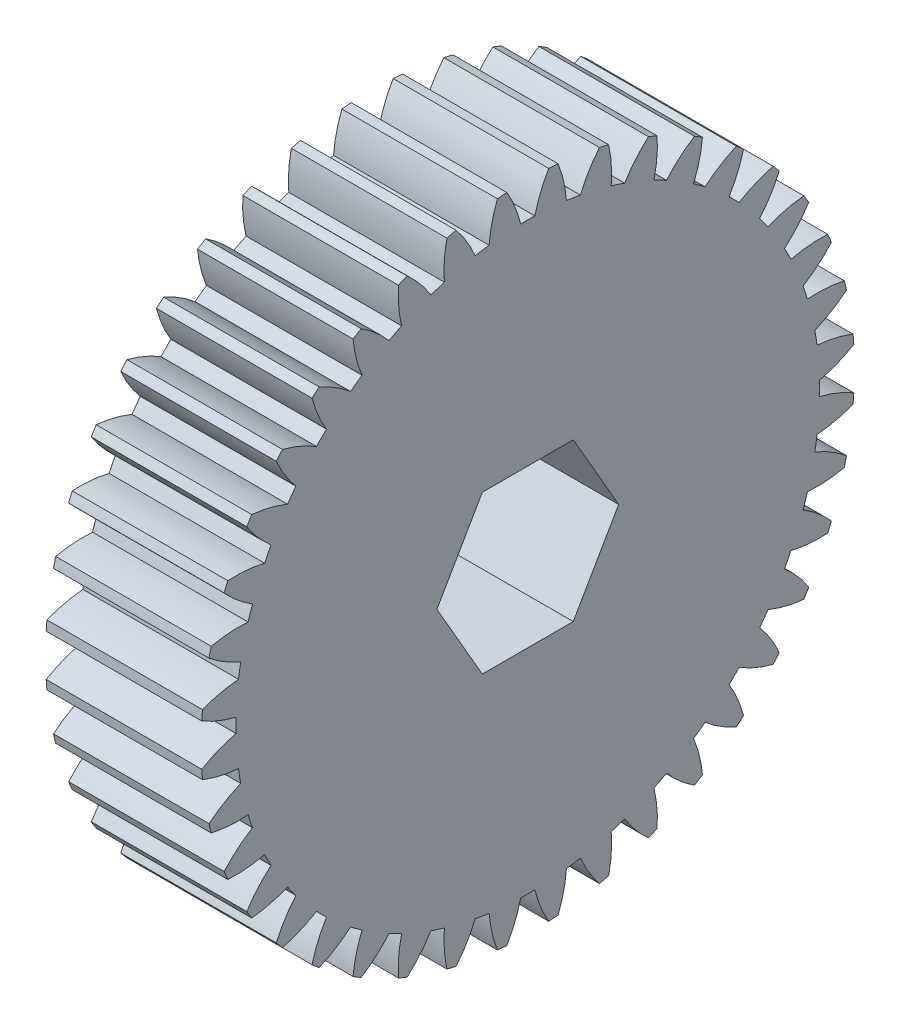
from build123d import *

# Parameters (mm, degrees)
BASPROSKE_W     = 12.7
BASPROSKE_H     = 26.67
TOOTHCUT_DEPTH  = 40.797836625
TEETHCUTS_DEPTH = 12.7
BORSKE_R        = 0.396875
BORE_DEPTH      = 50.8029464
HEX_HOLE_DEPTH  = 40.724573716


# Read off the part's stored shape, not the designer's step: TeethCuts
with BuildPart() as part:
    # BasProSke → Base-Revolve (revolve)
    with BuildSketch(Plane(origin=(0, 0, 0), x_dir=(1, 0, 0), z_dir=(0, 1, 0)), mode=Mode.PRIVATE) as base_revolve_sk:
        with Locations((6.35, 13.335)):
            Rectangle(BASPROSKE_W, BASPROSKE_H)
    revolve(base_revolve_sk.sketch.rotate(Axis((-10, 0, 0), (1, 0, 0)), 180), axis=Axis((-10, 0, 0), (1, 0, 0)))

    # TooCutSke → ToothCut (cut, through all)
    with BuildSketch(Plane(origin=(0, 0, 0), x_dir=(0, 0, -1), z_dir=(1, 0, 0))):
        with BuildLine():
            ThreePointArc((0.577296327, 23.818204886), (0, 23.8252), (-0.577296327, 23.818204886))
            ThreePointArc((-0.577296327, 23.818204886), (-1.042980967, 25.272123589), (-1.721261603, 26.639850594))
            ThreePointArc((-1.721261603, 26.639850594), (0, 26.6954), (1.721261603, 26.639850594))
            ThreePointArc((1.721261603, 26.639850594), (1.042980967, 25.272123589), (0.577296327, 23.818204886))
        make_face()
    extrude(amount=TOOTHCUT_DEPTH, mode=Mode.SUBTRACT)

    # TeethCuts outline → TeethCuts (cut)
    with BuildSketch(Plane.YZ):
        with BuildLine():
            ThreePointArc((26.020657032, 5.849299754), (24.785617983, 4.976229054), (23.434654218, 4.296176991))
            ThreePointArc((23.434654218, 4.296176991), (23.531872252, 3.727082416), (23.615272302, 3.155799288))
            ThreePointArc((23.615272302, 3.155799288), (25.110262838, 2.926502105), (26.554648458, 2.477810581))
            ThreePointArc((26.554648458, 2.477810581), (26.341648043, 4.172107183), (26.020657032, 5.849299754))
        make_face()
        with BuildLine():
            ThreePointArc((23.434654218, -4.296176991), (24.785617983, -4.976229054), (26.020657032, -5.849299754))
            ThreePointArc((26.020657032, -5.849299754), (26.341648043, -4.172107183), (26.554648458, -2.477810581))
            ThreePointArc((26.554648458, -2.477810581), (25.110262838, -2.926502105), (23.615272302, -3.155799288))
            ThreePointArc((23.615272302, -3.155799288), (23.531872252, -3.727082416), (23.434654218, -4.296176991))
        make_face()
        with BuildLine():
            ThreePointArc((22.474064587, -7.909271519), (23.702012166, -8.792288306), (24.785267487, -9.847812731))
            ThreePointArc((24.785267487, -9.847812731), (25.364677289, -8.24148324), (25.840101698, -6.601366847))
            ThreePointArc((25.840101698, -6.601366847), (24.343308043, -6.818582542), (22.830853339, -6.811188651))
            ThreePointArc((22.830853339, -6.811188651), (22.659111712, -7.362391694), (22.474064587, -7.909271519))
        make_face()
        with BuildLine():
            ThreePointArc((20.9600889, -11.327613533), (22.034784147, -12.391852241), (22.9395824, -13.603839875))
            ThreePointArc((22.9395824, -13.603839875), (23.763144, -12.107926628), (24.489285876, -10.562375552))
            ThreePointArc((24.489285876, -10.562375552), (22.976940214, -10.542766847), (21.484262996, -10.298863945))
            ThreePointArc((21.484262996, -10.298863945), (21.22840864, -10.816414454), (20.9600889, -11.327613533))
        make_face()
        with BuildLine():
            ThreePointArc((18.930006261, -14.467032108), (19.824986614, -15.686287647), (20.529048661, -17.024895332))
            ThreePointArc((20.529048661, -17.024895332), (21.57648324, -15.676232678), (22.53546256, -14.263303517))
            ThreePointArc((22.53546256, -14.263303517), (21.04480386, -14.007353243), (19.608658796, -13.532947028))
            ThreePointArc((19.608658796, -13.532947028), (19.274991694, -14.004101193), (18.930006261, -14.467032108))
        make_face()
        with BuildLine():
            ThreePointArc((16.433804043, -17.250224338), (17.127032114, -18.594474591), (17.613021612, -20.026741365))
            ThreePointArc((17.613021612, -20.026741365), (18.858537854, -18.858537854), (20.026741365, -17.613021612))
            ThreePointArc((20.026741365, -17.613021612), (18.594474591, -17.127032114), (17.250224338, -16.433804043))
            ThreePointArc((17.250224338, -16.433804043), (16.846960483, -16.846960483), (16.433804043, -17.250224338))
        make_face()
        with BuildLine():
            ThreePointArc((13.532947028, -19.608658796), (14.007353243, -21.04480386), (14.263303517, -22.53546256))
            ThreePointArc((14.263303517, -22.53546256), (15.676232678, -21.57648324), (17.024895332, -20.529048661))
            ThreePointArc((17.024895332, -20.529048661), (15.686287647, -19.824986614), (14.467032108, -18.930006261))
            ThreePointArc((14.467032108, -18.930006261), (14.004101193, -19.274991694), (13.532947028, -19.608658796))
        make_face()
        with BuildLine():
            ThreePointArc((10.298863945, -21.484262996), (10.542766847, -22.976940214), (10.562375552, -24.489285876))
            ThreePointArc((10.562375552, -24.489285876), (12.107926628, -23.763144), (13.603839875, -22.939582399))
            ThreePointArc((13.603839875, -22.939582399), (12.391852241, -22.034784147), (11.327613533, -20.9600889))
            ThreePointArc((11.327613533, -20.9600889), (10.816414454, -21.22840864), (10.298863945, -21.484262996))
        make_face()
        with BuildLine():
            ThreePointArc((6.811188651, -22.830853339), (6.818582542, -24.343308043), (6.601366847, -25.840101698))
            ThreePointArc((6.601366847, -25.840101698), (8.24148324, -25.364677289), (9.847812731, -24.785267487))
            ThreePointArc((9.847812731, -24.785267487), (8.792288306, -23.702012166), (7.909271519, -22.474064587))
            ThreePointArc((7.909271519, -22.474064587), (7.362391694, -22.659111712), (6.811188651, -22.830853339))
        make_face()
        with BuildLine():
            ThreePointArc((3.155799288, -23.615272302), (2.926502105, -25.110262838), (2.477810581, -26.554648458))
            ThreePointArc((2.477810581, -26.554648458), (4.172107183, -26.341648044), (5.849299754, -26.020657032))
            ThreePointArc((5.849299754, -26.020657032), (4.976229054, -24.785617983), (4.296176991, -23.434654218))
            ThreePointArc((4.296176991, -23.434654218), (3.727082416, -23.531872252), (3.155799288, -23.615272302))
        make_face()
        with BuildLine():
            ThreePointArc((-0.577296327, -23.818204886), (-1.037638527, -25.258919626), (-1.706757605, -26.615331643))
            ThreePointArc((-1.706757605, -26.615331643), (0, -26.67), (1.706757605, -26.615331643))
            ThreePointArc((1.706757605, -26.615331643), (1.037638527, -25.258919626), (0.577296327, -23.818204886))
            ThreePointArc((0.577296327, -23.818204886), (0, -23.8252), (-0.577296327, -23.818204886))
        make_face()
        with BuildLine():
            ThreePointArc((-4.296176991, -23.434654218), (-4.976229054, -24.785617983), (-5.849299754, -26.020657032))
            ThreePointArc((-5.849299754, -26.020657032), (-4.172107183, -26.341648044), (-2.477810581, -26.554648458))
            ThreePointArc((-2.477810581, -26.554648458), (-2.926502105, -25.110262838), (-3.155799288, -23.615272302))
            ThreePointArc((-3.155799288, -23.615272302), (-3.727082416, -23.531872252), (-4.296176991, -23.434654218))
        make_face()
        with BuildLine():
            ThreePointArc((-7.909271519, -22.474064587), (-8.792288306, -23.702012166), (-9.847812731, -24.785267487))
            ThreePointArc((-9.847812731, -24.785267487), (-8.24148324, -25.364677289), (-6.601366847, -25.840101698))
            ThreePointArc((-6.601366847, -25.840101698), (-6.818582542, -24.343308043), (-6.811188651, -22.830853339))
            ThreePointArc((-6.811188651, -22.830853339), (-7.362391694, -22.659111712), (-7.909271519, -22.474064587))
        make_face()
        with BuildLine():
            ThreePointArc((-11.327613533, -20.9600889), (-12.391852241, -22.034784147), (-13.603839875, -22.9395824))
            ThreePointArc((-13.603839875, -22.9395824), (-12.107926628, -23.763144), (-10.562375552, -24.489285876))
            ThreePointArc((-10.562375552, -24.489285876), (-10.542766847, -22.976940214), (-10.298863945, -21.484262996))
            ThreePointArc((-10.298863945, -21.484262996), (-10.816414454, -21.22840864), (-11.327613533, -20.9600889))
        make_face()
        with BuildLine():
            ThreePointArc((-14.467032108, -18.930006261), (-15.686287647, -19.824986614), (-17.024895332, -20.529048661))
            ThreePointArc((-17.024895332, -20.529048661), (-15.676232678, -21.57648324), (-14.263303517, -22.53546256))
            ThreePointArc((-14.263303517, -22.53546256), (-14.007353243, -21.04480386), (-13.532947028, -19.608658796))
            ThreePointArc((-13.532947028, -19.608658796), (-14.004101193, -19.274991694), (-14.467032108, -18.930006261))
        make_face()
        with BuildLine():
            ThreePointArc((-17.250224338, -16.433804043), (-18.594474591, -17.127032114), (-20.026741365, -17.613021612))
            ThreePointArc((-20.026741365, -17.613021612), (-18.858537854, -18.858537854), (-17.613021612, -20.026741365))
            ThreePointArc((-17.613021612, -20.026741365), (-17.127032114, -18.594474591), (-16.433804043, -17.250224338))
            ThreePointArc((-16.433804043, -17.250224338), (-16.846960483, -16.846960483), (-17.250224338, -16.433804043))
        make_face()
        with BuildLine():
            ThreePointArc((-19.608658796, -13.532947028), (-21.04480386, -14.007353243), (-22.53546256, -14.263303517))
            ThreePointArc((-22.53546256, -14.263303517), (-21.57648324, -15.676232678), (-20.529048661, -17.024895332))
            ThreePointArc((-20.529048661, -17.024895332), (-19.824986614, -15.686287647), (-18.930006261, -14.467032108))
            ThreePointArc((-18.930006261, -14.467032108), (-19.274991694, -14.004101193), (-19.608658796, -13.532947028))
        make_face()
        with BuildLine():
            ThreePointArc((-21.484262996, -10.298863945), (-22.976940214, -10.542766847), (-24.489285876, -10.562375552))
            ThreePointArc((-24.489285876, -10.562375552), (-23.763144, -12.107926628), (-22.939582399, -13.603839875))
            ThreePointArc((-22.939582399, -13.603839875), (-22.034784147, -12.391852241), (-20.9600889, -11.327613533))
            ThreePointArc((-20.9600889, -11.327613533), (-21.22840864, -10.816414454), (-21.484262996, -10.298863945))
        make_face()
        with BuildLine():
            ThreePointArc((-22.830853339, -6.811188651), (-24.343308043, -6.818582542), (-25.840101698, -6.601366847))
            ThreePointArc((-25.840101698, -6.601366847), (-25.364677289, -8.24148324), (-24.785267487, -9.847812731))
            ThreePointArc((-24.785267487, -9.847812731), (-23.702012166, -8.792288306), (-22.474064587, -7.909271519))
            ThreePointArc((-22.474064587, -7.909271519), (-22.659111712, -7.362391694), (-22.830853339, -6.811188651))
        make_face()
        with BuildLine():
            ThreePointArc((-23.615272302, -3.155799288), (-25.110262838, -2.926502105), (-26.554648458, -2.477810581))
            ThreePointArc((-26.554648458, -2.477810581), (-26.341648044, -4.172107183), (-26.020657032, -5.849299754))
            ThreePointArc((-26.020657032, -5.849299754), (-24.785617983, -4.976229054), (-23.434654218, -4.296176991))
            ThreePointArc((-23.434654218, -4.296176991), (-23.531872252, -3.727082416), (-23.615272302, -3.155799288))
        make_face()
        with BuildLine():
            ThreePointArc((-23.818204886, 0.577296327), (-25.258919626, 1.037638527), (-26.615331643, 1.706757605))
            ThreePointArc((-26.615331643, 1.706757605), (-26.67, 0), (-26.615331643, -1.706757605))
            ThreePointArc((-26.615331643, -1.706757605), (-25.258919626, -1.037638527), (-23.818204886, -0.577296327))
            ThreePointArc((-23.818204886, -0.577296327), (-23.8252, 0), (-23.818204886, 0.577296327))
        make_face()
        with BuildLine():
            ThreePointArc((-23.434654218, 4.296176991), (-24.785617983, 4.976229054), (-26.020657032, 5.849299754))
            ThreePointArc((-26.020657032, 5.849299754), (-26.341648044, 4.172107183), (-26.554648458, 2.477810581))
            ThreePointArc((-26.554648458, 2.477810581), (-25.110262838, 2.926502105), (-23.615272302, 3.155799288))
            ThreePointArc((-23.615272302, 3.155799288), (-23.531872252, 3.727082416), (-23.434654218, 4.296176991))
        make_face()
        with BuildLine():
            ThreePointArc((-22.474064587, 7.909271519), (-23.702012166, 8.792288306), (-24.785267487, 9.847812731))
            ThreePointArc((-24.785267487, 9.847812731), (-25.364677289, 8.24148324), (-25.840101698, 6.601366847))
            ThreePointArc((-25.840101698, 6.601366847), (-24.343308043, 6.818582542), (-22.830853339, 6.811188651))
            ThreePointArc((-22.830853339, 6.811188651), (-22.659111712, 7.362391694), (-22.474064587, 7.909271519))
        make_face()
        with BuildLine():
            ThreePointArc((-20.9600889, 11.327613533), (-22.034784147, 12.391852241), (-22.9395824, 13.603839875))
            ThreePointArc((-22.9395824, 13.603839875), (-23.763144, 12.107926628), (-24.489285876, 10.562375552))
            ThreePointArc((-24.489285876, 10.562375552), (-22.976940214, 10.542766847), (-21.484262996, 10.298863945))
            ThreePointArc((-21.484262996, 10.298863945), (-21.22840864, 10.816414454), (-20.9600889, 11.327613533))
        make_face()
        with BuildLine():
            ThreePointArc((-18.930006261, 14.467032108), (-19.824986614, 15.686287647), (-20.529048661, 17.024895332))
            ThreePointArc((-20.529048661, 17.024895332), (-21.57648324, 15.676232678), (-22.53546256, 14.263303517))
            ThreePointArc((-22.53546256, 14.263303517), (-21.04480386, 14.007353243), (-19.608658796, 13.532947028))
            ThreePointArc((-19.608658796, 13.532947028), (-19.274991694, 14.004101193), (-18.930006261, 14.467032108))
        make_face()
        with BuildLine():
            ThreePointArc((-16.433804043, 17.250224338), (-17.127032114, 18.594474591), (-17.613021612, 20.026741365))
            ThreePointArc((-17.613021612, 20.026741365), (-18.858537854, 18.858537854), (-20.026741365, 17.613021612))
            ThreePointArc((-20.026741365, 17.613021612), (-18.594474591, 17.127032114), (-17.250224338, 16.433804043))
            ThreePointArc((-17.250224338, 16.433804043), (-16.846960483, 16.846960483), (-16.433804043, 17.250224338))
        make_face()
        with BuildLine():
            ThreePointArc((-13.532947028, 19.608658796), (-14.007353243, 21.04480386), (-14.263303517, 22.53546256))
            ThreePointArc((-14.263303517, 22.53546256), (-15.676232678, 21.57648324), (-17.024895332, 20.529048661))
            ThreePointArc((-17.024895332, 20.529048661), (-15.686287647, 19.824986614), (-14.467032108, 18.930006261))
            ThreePointArc((-14.467032108, 18.930006261), (-14.004101193, 19.274991694), (-13.532947028, 19.608658796))
        make_face()
        with BuildLine():
            ThreePointArc((-10.298863945, 21.484262996), (-10.542766847, 22.976940214), (-10.562375552, 24.489285876))
            ThreePointArc((-10.562375552, 24.489285876), (-12.107926628, 23.763144), (-13.603839875, 22.939582399))
            ThreePointArc((-13.603839875, 22.939582399), (-12.391852241, 22.034784147), (-11.327613533, 20.9600889))
            ThreePointArc((-11.327613533, 20.9600889), (-10.816414454, 21.22840864), (-10.298863945, 21.484262996))
        make_face()
        with BuildLine():
            ThreePointArc((-6.811188651, 22.830853339), (-6.818582542, 24.343308043), (-6.601366847, 25.840101698))
            ThreePointArc((-6.601366847, 25.840101698), (-8.24148324, 25.364677289), (-9.847812731, 24.785267487))
            ThreePointArc((-9.847812731, 24.785267487), (-8.792288306, 23.702012166), (-7.909271519, 22.474064587))
            ThreePointArc((-7.909271519, 22.474064587), (-7.362391694, 22.659111712), (-6.811188651, 22.830853339))
        make_face()
        with BuildLine():
            ThreePointArc((-3.155799288, 23.615272302), (-2.926502105, 25.110262838), (-2.477810581, 26.554648458))
            ThreePointArc((-2.477810581, 26.554648458), (-4.172107183, 26.341648044), (-5.849299754, 26.020657032))
            ThreePointArc((-5.849299754, 26.020657032), (-4.976229054, 24.785617983), (-4.296176991, 23.434654218))
            ThreePointArc((-4.296176991, 23.434654218), (-3.727082416, 23.531872252), (-3.155799288, 23.615272302))
        make_face()
        with BuildLine():
            ThreePointArc((0.577296327, 23.818204886), (1.037638527, 25.258919626), (1.706757605, 26.615331643))
            ThreePointArc((1.706757605, 26.615331643), (0, 26.67), (-1.706757605, 26.615331643))
            ThreePointArc((-1.706757605, 26.615331643), (-1.037638527, 25.258919626), (-0.577296327, 23.818204886))
            ThreePointArc((-0.577296327, 23.818204886), (0, 23.8252), (0.577296327, 23.818204886))
        make_face()
        with BuildLine():
            ThreePointArc((4.296176991, 23.434654218), (4.976229054, 24.785617983), (5.849299754, 26.020657032))
            ThreePointArc((5.849299754, 26.020657032), (4.172107183, 26.341648044), (2.477810581, 26.554648458))
            ThreePointArc((2.477810581, 26.554648458), (2.926502105, 25.110262838), (3.155799288, 23.615272302))
            ThreePointArc((3.155799288, 23.615272302), (3.727082416, 23.531872252), (4.296176991, 23.434654218))
        make_face()
        with BuildLine():
            ThreePointArc((7.909271519, 22.474064587), (8.792288306, 23.702012166), (9.847812731, 24.785267487))
            ThreePointArc((9.847812731, 24.785267487), (8.24148324, 25.364677289), (6.601366847, 25.840101698))
            ThreePointArc((6.601366847, 25.840101698), (6.818582542, 24.343308043), (6.811188651, 22.830853339))
            ThreePointArc((6.811188651, 22.830853339), (7.362391694, 22.659111712), (7.909271519, 22.474064587))
        make_face()
        with BuildLine():
            ThreePointArc((11.327613533, 20.9600889), (12.391852241, 22.034784147), (13.603839875, 22.9395824))
            ThreePointArc((13.603839875, 22.9395824), (12.107926628, 23.763144), (10.562375552, 24.489285876))
            ThreePointArc((10.562375552, 24.489285876), (10.542766847, 22.976940214), (10.298863945, 21.484262996))
            ThreePointArc((10.298863945, 21.484262996), (10.816414454, 21.22840864), (11.327613533, 20.9600889))
        make_face()
        with BuildLine():
            ThreePointArc((14.467032108, 18.930006261), (15.686287647, 19.824986614), (17.024895332, 20.529048661))
            ThreePointArc((17.024895332, 20.529048661), (15.676232678, 21.57648324), (14.263303517, 22.53546256))
            ThreePointArc((14.263303517, 22.53546256), (14.007353243, 21.04480386), (13.532947028, 19.608658796))
            ThreePointArc((13.532947028, 19.608658796), (14.004101193, 19.274991694), (14.467032108, 18.930006261))
        make_face()
        with BuildLine():
            ThreePointArc((17.250224338, 16.433804043), (18.594474591, 17.127032114), (20.026741365, 17.613021612))
            ThreePointArc((20.026741365, 17.613021612), (18.858537854, 18.858537854), (17.613021612, 20.026741365))
            ThreePointArc((17.613021612, 20.026741365), (17.127032114, 18.594474591), (16.433804043, 17.250224338))
            ThreePointArc((16.433804043, 17.250224338), (16.846960483, 16.846960483), (17.250224338, 16.433804043))
        make_face()
        with BuildLine():
            ThreePointArc((19.608658796, 13.532947028), (21.04480386, 14.007353243), (22.53546256, 14.263303517))
            ThreePointArc((22.53546256, 14.263303517), (21.57648324, 15.676232678), (20.529048661, 17.024895332))
            ThreePointArc((20.529048661, 17.024895332), (19.824986614, 15.686287647), (18.930006261, 14.467032108))
            ThreePointArc((18.930006261, 14.467032108), (19.274991694, 14.004101193), (19.608658796, 13.532947028))
        make_face()
        with BuildLine():
            ThreePointArc((21.484262996, 10.298863945), (22.976940214, 10.542766847), (24.489285876, 10.562375552))
            ThreePointArc((24.489285876, 10.562375552), (23.763144, 12.107926628), (22.939582399, 13.603839875))
            ThreePointArc((22.939582399, 13.603839875), (22.034784147, 12.391852241), (20.9600889, 11.327613533))
            ThreePointArc((20.9600889, 11.327613533), (21.22840864, 10.816414454), (21.484262996, 10.298863945))
        make_face()
        with BuildLine():
            ThreePointArc((22.830853339, 6.811188651), (24.343308043, 6.818582542), (25.840101698, 6.601366847))
            ThreePointArc((25.840101698, 6.601366847), (25.364677289, 8.24148324), (24.785267487, 9.847812731))
            ThreePointArc((24.785267487, 9.847812731), (23.702012166, 8.792288306), (22.474064587, 7.909271519))
            ThreePointArc((22.474064587, 7.909271519), (22.659111712, 7.362391694), (22.830853339, 6.811188651))
        make_face()
    extrude(amount=TEETHCUTS_DEPTH, mode=Mode.SUBTRACT)

    # BorSke → Bore (cut, symmetric)
    with BuildSketch(Plane(origin=(0, 0, 0), x_dir=(0, 0, -1), z_dir=(1, 0, 0))):
        with Locations(Location((0, 0, 0), (0, 0, 180))):
            Circle(BORSKE_R)
    extrude(amount=BORE_DEPTH, both=True, mode=Mode.SUBTRACT)

    # Sketch3 → Hex Hole (cut, through all)
    with BuildSketch(Plane.ZY):
        Polygon((7.418950933, 0), (3.709475466, 6.424999977), (-3.709475466, 6.424999977), (-7.418950933, 0), (-3.709475466, -6.424999977), (3.709475466, -6.424999977), align=None)
    extrude(amount=-HEX_HOLE_DEPTH, mode=Mode.SUBTRACT)


solid = part.part
